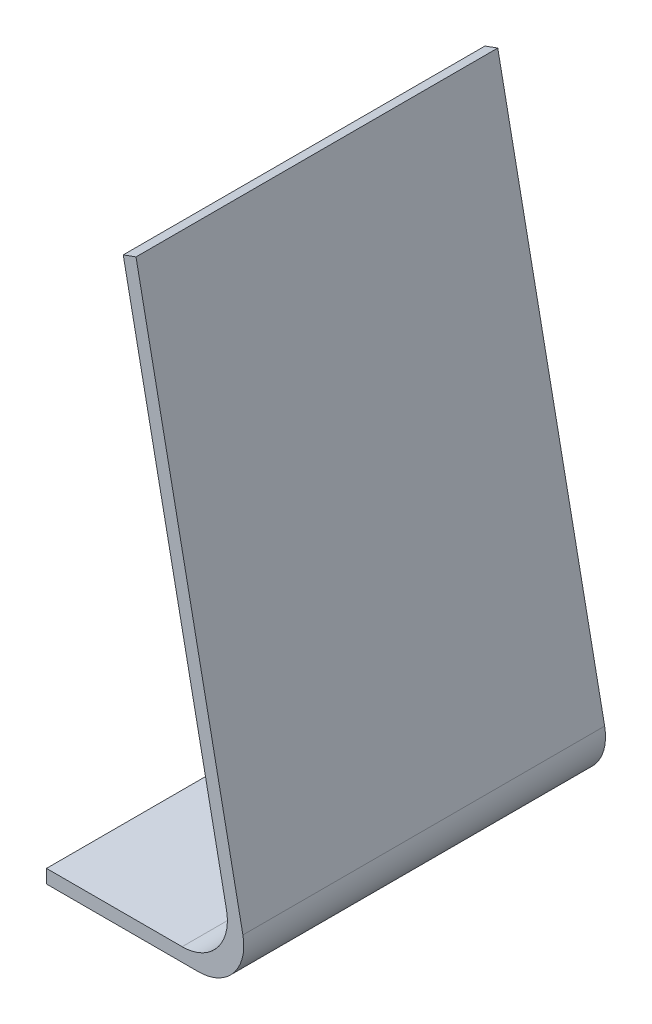
from build123d import *

# Parameters (mm, degrees)
BOSS_EXTRUDE1_DEPTH = 40


with BuildPart() as part:
    # Sketch1 → Boss-Extrude1 (new, symmetric)
    with BuildSketch(Plane.XY):
        with BuildLine():
            Line((-50.530004832, 0), (-50.530004832, 3))
            Line((-50.530004832, 3), (-20.530004832, 3))
            ThreePointArc((-20.530004832, 3), (-12.795745616, 6.661133037), (-10.724716786, 14.963753125))
            Line((-10.724716786, 14.963753125), (-33.559523327, 128.981066609))
            Line((-33.559523327, 128.981066609), (-30.737861628, 130))
            Line((-30.737861628, 130), (-7.098163586, 11.963753125))
            ThreePointArc((-7.098163586, 11.963753125), (-9.169192416, 3.661133037), (-16.903451632, 0))
            Line((-16.903451632, 0), (-50.530004832, 0))
        make_face()
    extrude(amount=BOSS_EXTRUDE1_DEPTH, both=True)


solid = part.part
